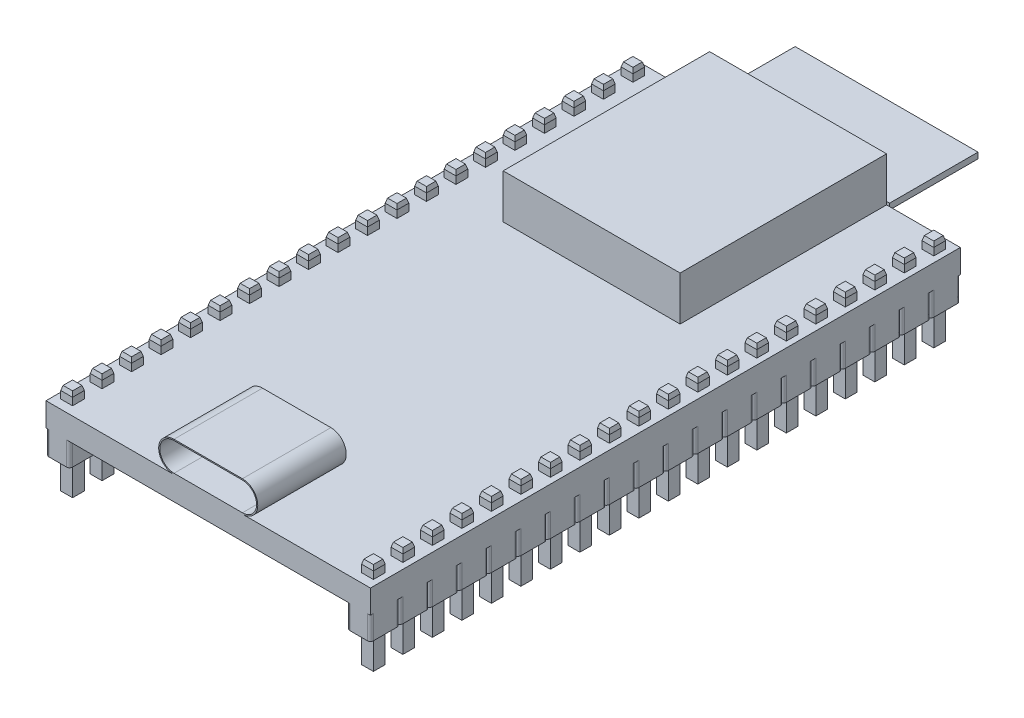
from build123d import *
from OCP.BRepFilletAPI import BRepFilletAPI_MakeChamfer

# Parameters (mm, degrees)
SKETCH1_W                = 27.5
SKETCH1_H                = 50
BOSS_EXTRUDE1_DEPTH      = 2
BOSS_EXTRUDE2_DEPTH      = 2
BOSS_EXTRUDE3_DEPTH      = 2.75
BOSS_EXTRUDE3_DEPTH_BACK = 5
SKETCH3_W                = 1
SKETCH3_H                = 1
SKETCH4_W                = 15
SKETCH4_H                = 17.5
BOSS_EXTRUDE4_DEPTH      = 3.75
SKETCH5_W                = 15.5
SKETCH5_H                = 0.5
BOSS_EXTRUDE5_DEPTH      = 7.5
CHAMFER1_SIZE            = 0.1
CHAMFER1_SIZE2           = 0.373205081
BOSS_EXTRUDE6_DEPTH      = 7.5
BOSS_EXTRUDE7_START      = -0.1
BOSS_EXTRUDE7_DEPTH      = 0.1


with BuildPart() as part:
    # Sketch1 → Boss-Extrude1 (new body)
    with BuildSketch(Plane(origin=(0, 0, 0), x_dir=(1, 0, 0), z_dir=(0, 1, 0))):
        Rectangle(SKETCH1_W, SKETCH1_H)
    extrude(amount=BOSS_EXTRUDE1_DEPTH)

    # Sketch2 → Boss-Extrude2 (add)
    with BuildSketch(Plane.XZ):
        with BuildLine():
            ThreePointArc((-11.75, 22.25), (-11.823223305, 22.426776695), (-12, 22.5))
            ThreePointArc((-12, 22.5), (-11.823223305, 22.573223305), (-11.75, 22.75))
            Line((-11.75, 22.75), (-11.75, 24.75))
            ThreePointArc((-11.75, 24.75), (-11.823223305, 24.926776695), (-12, 25))
            Line((-12, 25), (-13.5, 25))
            ThreePointArc((-13.5, 25), (-13.676776695, 24.926776695), (-13.75, 24.75))
            Line((-13.75, 24.75), (-13.75, 22.75))
            ThreePointArc((-13.75, 22.75), (-13.676776695, 22.573223305), (-13.5, 22.5))
            ThreePointArc((-13.5, 22.5), (-13.676776695, 22.426776695), (-13.75, 22.25))
            Line((-13.75, 22.25), (-13.75, 20.25))
            ThreePointArc((-13.75, 20.25), (-13.676776695, 20.073223305), (-13.5, 20))
            ThreePointArc((-13.5, 20), (-13.676776695, 19.926776695), (-13.75, 19.75))
            Line((-13.75, 19.75), (-13.75, 17.75))
            ThreePointArc((-13.75, 17.75), (-13.676776695, 17.573223305), (-13.5, 17.5))
            ThreePointArc((-13.5, 17.5), (-13.676776695, 17.426776695), (-13.75, 17.25))
            Line((-13.75, 17.25), (-13.75, 15.25))
            ThreePointArc((-13.75, 15.25), (-13.676776695, 15.073223305), (-13.5, 15))
            ThreePointArc((-13.5, 15), (-13.676776695, 14.926776695), (-13.75, 14.75))
            Line((-13.75, 14.75), (-13.75, 12.75))
            ThreePointArc((-13.75, 12.75), (-13.676776695, 12.573223305), (-13.5, 12.5))
            ThreePointArc((-13.5, 12.5), (-13.676776695, 12.426776695), (-13.75, 12.25))
            Line((-13.75, 12.25), (-13.75, 10.25))
            ThreePointArc((-13.75, 10.25), (-13.676776695, 10.073223305), (-13.5, 10))
            ThreePointArc((-13.5, 10), (-13.676776695, 9.926776695), (-13.75, 9.75))
            Line((-13.75, 9.75), (-13.75, 7.75))
            ThreePointArc((-13.75, 7.75), (-13.676776695, 7.573223305), (-13.5, 7.5))
            ThreePointArc((-13.5, 7.5), (-13.676776695, 7.426776695), (-13.75, 7.25))
            Line((-13.75, 7.25), (-13.75, 5.25))
            ThreePointArc((-13.75, 5.25), (-13.676776695, 5.073223305), (-13.5, 5))
            ThreePointArc((-13.5, 5), (-13.676776695, 4.926776695), (-13.75, 4.75))
            Line((-13.75, 4.75), (-13.75, 2.75))
            ThreePointArc((-13.75, 2.75), (-13.676776695, 2.573223305), (-13.5, 2.5))
            ThreePointArc((-13.5, 2.5), (-13.676776695, 2.426776695), (-13.75, 2.25))
            Line((-13.75, 2.25), (-13.75, 0.25))
            ThreePointArc((-13.75, 0.25), (-13.676776695, 0.073223305), (-13.5, 0))
            ThreePointArc((-13.5, 0), (-13.676776695, -0.073223305), (-13.75, -0.25))
            Line((-13.75, -0.25), (-13.75, -2.25))
            ThreePointArc((-13.75, -2.25), (-13.676776695, -2.426776695), (-13.5, -2.5))
            ThreePointArc((-13.5, -2.5), (-13.676776695, -2.573223305), (-13.75, -2.75))
            Line((-13.75, -2.75), (-13.75, -4.75))
            ThreePointArc((-13.75, -4.75), (-13.676776695, -4.926776695), (-13.5, -5))
            ThreePointArc((-13.5, -5), (-13.676776695, -5.073223305), (-13.75, -5.25))
            Line((-13.75, -5.25), (-13.75, -7.25))
            ThreePointArc((-13.75, -7.25), (-13.676776695, -7.426776695), (-13.5, -7.5))
            ThreePointArc((-13.5, -7.5), (-13.676776695, -7.573223305), (-13.75, -7.75))
            Line((-13.75, -7.75), (-13.75, -9.75))
            ThreePointArc((-13.75, -9.75), (-13.676776695, -9.926776695), (-13.5, -10))
            ThreePointArc((-13.5, -10), (-13.676776695, -10.073223305), (-13.75, -10.25))
            Line((-13.75, -10.25), (-13.75, -12.25))
            ThreePointArc((-13.75, -12.25), (-13.676776695, -12.426776695), (-13.5, -12.5))
            ThreePointArc((-13.5, -12.5), (-13.676776695, -12.573223305), (-13.75, -12.75))
            Line((-13.75, -12.75), (-13.75, -14.75))
            ThreePointArc((-13.75, -14.75), (-13.676776695, -14.926776695), (-13.5, -15))
            ThreePointArc((-13.5, -15), (-13.676776695, -15.073223305), (-13.75, -15.25))
            Line((-13.75, -15.25), (-13.75, -17.25))
            ThreePointArc((-13.75, -17.25), (-13.676776695, -17.426776695), (-13.5, -17.5))
            ThreePointArc((-13.5, -17.5), (-13.676776695, -17.573223305), (-13.75, -17.75))
            Line((-13.75, -17.75), (-13.75, -19.75))
            ThreePointArc((-13.75, -19.75), (-13.676776695, -19.926776695), (-13.5, -20))
            ThreePointArc((-13.5, -20), (-13.676776695, -20.073223305), (-13.75, -20.25))
            Line((-13.75, -20.25), (-13.75, -22.25))
            ThreePointArc((-13.75, -22.25), (-13.676776695, -22.426776695), (-13.5, -22.5))
            ThreePointArc((-13.5, -22.5), (-13.676776695, -22.573223305), (-13.75, -22.75))
            Line((-13.75, -22.75), (-13.75, -24.75))
            ThreePointArc((-13.75, -24.75), (-13.676776695, -24.926776695), (-13.5, -25))
            Line((-13.5, -25), (-12, -25))
            ThreePointArc((-12, -25), (-11.823223305, -24.926776695), (-11.75, -24.75))
            Line((-11.75, -24.75), (-11.75, -22.75))
            ThreePointArc((-11.75, -22.75), (-11.823223305, -22.573223305), (-12, -22.5))
            ThreePointArc((-12, -22.5), (-11.823223305, -22.426776695), (-11.75, -22.25))
            Line((-11.75, -22.25), (-11.75, -20.25))
            ThreePointArc((-11.75, -20.25), (-11.823223305, -20.073223305), (-12, -20))
            ThreePointArc((-12, -20), (-11.823223305, -19.926776695), (-11.75, -19.75))
            Line((-11.75, -19.75), (-11.75, -17.75))
            ThreePointArc((-11.75, -17.75), (-11.823223305, -17.573223305), (-12, -17.5))
            ThreePointArc((-12, -17.5), (-11.823223305, -17.426776695), (-11.75, -17.25))
            Line((-11.75, -17.25), (-11.75, -15.25))
            ThreePointArc((-11.75, -15.25), (-11.823223305, -15.073223305), (-12, -15))
            ThreePointArc((-12, -15), (-11.823223305, -14.926776695), (-11.75, -14.75))
            Line((-11.75, -14.75), (-11.75, -12.75))
            ThreePointArc((-11.75, -12.75), (-11.823223305, -12.573223305), (-12, -12.5))
            ThreePointArc((-12, -12.5), (-11.823223305, -12.426776695), (-11.75, -12.25))
            Line((-11.75, -12.25), (-11.75, -10.25))
            ThreePointArc((-11.75, -10.25), (-11.823223305, -10.073223305), (-12, -10))
            ThreePointArc((-12, -10), (-11.823223305, -9.926776695), (-11.75, -9.75))
            Line((-11.75, -9.75), (-11.75, -7.75))
            ThreePointArc((-11.75, -7.75), (-11.823223305, -7.573223305), (-12, -7.5))
            ThreePointArc((-12, -7.5), (-11.823223305, -7.426776695), (-11.75, -7.25))
            Line((-11.75, -7.25), (-11.75, -5.25))
            ThreePointArc((-11.75, -5.25), (-11.823223305, -5.073223305), (-12, -5))
            ThreePointArc((-12, -5), (-11.823223305, -4.926776695), (-11.75, -4.75))
            Line((-11.75, -4.75), (-11.75, -2.75))
            ThreePointArc((-11.75, -2.75), (-11.823223305, -2.573223305), (-12, -2.5))
            ThreePointArc((-12, -2.5), (-11.823223305, -2.426776695), (-11.75, -2.25))
            Line((-11.75, -2.25), (-11.75, -0.25))
            ThreePointArc((-11.75, -0.25), (-11.823223305, -0.073223305), (-12, 0))
            ThreePointArc((-12, 0), (-11.823223305, 0.073223305), (-11.75, 0.25))
            Line((-11.75, 0.25), (-11.75, 2.25))
            ThreePointArc((-11.75, 2.25), (-11.823223305, 2.426776695), (-12, 2.5))
            ThreePointArc((-12, 2.5), (-11.823223305, 2.573223305), (-11.75, 2.75))
            Line((-11.75, 2.75), (-11.75, 4.75))
            ThreePointArc((-11.75, 4.75), (-11.823223305, 4.926776695), (-12, 5))
            ThreePointArc((-12, 5), (-11.823223305, 5.073223305), (-11.75, 5.25))
            Line((-11.75, 5.25), (-11.75, 7.25))
            ThreePointArc((-11.75, 7.25), (-11.823223305, 7.426776695), (-12, 7.5))
            ThreePointArc((-12, 7.5), (-11.823223305, 7.573223305), (-11.75, 7.75))
            Line((-11.75, 7.75), (-11.75, 9.75))
            ThreePointArc((-11.75, 9.75), (-11.823223305, 9.926776695), (-12, 10))
            ThreePointArc((-12, 10), (-11.823223305, 10.073223305), (-11.75, 10.25))
            Line((-11.75, 10.25), (-11.75, 12.25))
            ThreePointArc((-11.75, 12.25), (-11.823223305, 12.426776695), (-12, 12.5))
            ThreePointArc((-12, 12.5), (-11.823223305, 12.573223305), (-11.75, 12.75))
            Line((-11.75, 12.75), (-11.75, 14.75))
            ThreePointArc((-11.75, 14.75), (-11.823223305, 14.926776695), (-12, 15))
            ThreePointArc((-12, 15), (-11.823223305, 15.073223305), (-11.75, 15.25))
            Line((-11.75, 15.25), (-11.75, 17.25))
            ThreePointArc((-11.75, 17.25), (-11.823223305, 17.426776695), (-12, 17.5))
            ThreePointArc((-12, 17.5), (-11.823223305, 17.573223305), (-11.75, 17.75))
            Line((-11.75, 17.75), (-11.75, 19.75))
            ThreePointArc((-11.75, 19.75), (-11.823223305, 19.926776695), (-12, 20))
            ThreePointArc((-12, 20), (-11.823223305, 20.073223305), (-11.75, 20.25))
            Line((-11.75, 20.25), (-11.75, 22.25))
        make_face()
        with BuildLine():
            Line((13.5, 25), (12, 25))
            ThreePointArc((12, 25), (11.823223305, 24.926776695), (11.75, 24.75))
            Line((11.75, 24.75), (11.75, 22.75))
            ThreePointArc((11.75, 22.75), (11.823223305, 22.573223305), (12, 22.5))
            ThreePointArc((12, 22.5), (11.823223305, 22.426776695), (11.75, 22.25))
            Line((11.75, 22.25), (11.75, 20.25))
            ThreePointArc((11.75, 20.25), (11.823223305, 20.073223305), (12, 20))
            ThreePointArc((12, 20), (11.823223305, 19.926776695), (11.75, 19.75))
            Line((11.75, 19.75), (11.75, 17.75))
            ThreePointArc((11.75, 17.75), (11.823223305, 17.573223305), (12, 17.5))
            ThreePointArc((12, 17.5), (11.823223305, 17.426776695), (11.75, 17.25))
            Line((11.75, 17.25), (11.75, 15.25))
            ThreePointArc((11.75, 15.25), (11.823223305, 15.073223305), (12, 15))
            ThreePointArc((12, 15), (11.823223305, 14.926776695), (11.75, 14.75))
            Line((11.75, 14.75), (11.75, 12.75))
            ThreePointArc((11.75, 12.75), (11.823223305, 12.573223305), (12, 12.5))
            ThreePointArc((12, 12.5), (11.823223305, 12.426776695), (11.75, 12.25))
            Line((11.75, 12.25), (11.75, 10.25))
            ThreePointArc((11.75, 10.25), (11.823223305, 10.073223305), (12, 10))
            ThreePointArc((12, 10), (11.823223305, 9.926776695), (11.75, 9.75))
            Line((11.75, 9.75), (11.75, 7.75))
            ThreePointArc((11.75, 7.75), (11.823223305, 7.573223305), (12, 7.5))
            ThreePointArc((12, 7.5), (11.823223305, 7.426776695), (11.75, 7.25))
            Line((11.75, 7.25), (11.75, 5.25))
            ThreePointArc((11.75, 5.25), (11.823223305, 5.073223305), (12, 5))
            ThreePointArc((12, 5), (11.823223305, 4.926776695), (11.75, 4.75))
            Line((11.75, 4.75), (11.75, 2.75))
            ThreePointArc((11.75, 2.75), (11.823223305, 2.573223305), (12, 2.5))
            ThreePointArc((12, 2.5), (11.823223305, 2.426776695), (11.75, 2.25))
            Line((11.75, 2.25), (11.75, 0.25))
            ThreePointArc((11.75, 0.25), (11.823223305, 0.073223305), (12, 0))
            ThreePointArc((12, 0), (11.823223305, -0.073223305), (11.75, -0.25))
            Line((11.75, -0.25), (11.75, -2.25))
            ThreePointArc((11.75, -2.25), (11.823223305, -2.426776695), (12, -2.5))
            ThreePointArc((12, -2.5), (11.823223305, -2.573223305), (11.75, -2.75))
            Line((11.75, -2.75), (11.75, -4.75))
            ThreePointArc((11.75, -4.75), (11.823223305, -4.926776695), (12, -5))
            ThreePointArc((12, -5), (11.823223305, -5.073223305), (11.75, -5.25))
            Line((11.75, -5.25), (11.75, -7.25))
            ThreePointArc((11.75, -7.25), (11.823223305, -7.426776695), (12, -7.5))
            ThreePointArc((12, -7.5), (11.823223305, -7.573223305), (11.75, -7.75))
            Line((11.75, -7.75), (11.75, -9.75))
            ThreePointArc((11.75, -9.75), (11.823223305, -9.926776695), (12, -10))
            ThreePointArc((12, -10), (11.823223305, -10.073223305), (11.75, -10.25))
            Line((11.75, -10.25), (11.75, -12.25))
            ThreePointArc((11.75, -12.25), (11.823223305, -12.426776695), (12, -12.5))
            ThreePointArc((12, -12.5), (11.823223305, -12.573223305), (11.75, -12.75))
            Line((11.75, -12.75), (11.75, -14.75))
            ThreePointArc((11.75, -14.75), (11.823223305, -14.926776695), (12, -15))
            ThreePointArc((12, -15), (11.823223305, -15.073223305), (11.75, -15.25))
            Line((11.75, -15.25), (11.75, -17.25))
            ThreePointArc((11.75, -17.25), (11.823223305, -17.426776695), (12, -17.5))
            ThreePointArc((12, -17.5), (11.823223305, -17.573223305), (11.75, -17.75))
            Line((11.75, -17.75), (11.75, -19.75))
            ThreePointArc((11.75, -19.75), (11.823223305, -19.926776695), (12, -20))
            ThreePointArc((12, -20), (11.823223305, -20.073223305), (11.75, -20.25))
            Line((11.75, -20.25), (11.75, -22.25))
            ThreePointArc((11.75, -22.25), (11.823223305, -22.426776695), (12, -22.5))
            ThreePointArc((12, -22.5), (11.823223305, -22.573223305), (11.75, -22.75))
            Line((11.75, -22.75), (11.75, -24.75))
            ThreePointArc((11.75, -24.75), (11.823223305, -24.926776695), (12, -25))
            Line((12, -25), (13.5, -25))
            ThreePointArc((13.5, -25), (13.676776695, -24.926776695), (13.75, -24.75))
            Line((13.75, -24.75), (13.75, -22.75))
            ThreePointArc((13.75, -22.75), (13.676776695, -22.573223305), (13.5, -22.5))
            ThreePointArc((13.5, -22.5), (13.676776695, -22.426776695), (13.75, -22.25))
            Line((13.75, -22.25), (13.75, -20.25))
            ThreePointArc((13.75, -20.25), (13.676776695, -20.073223305), (13.5, -20))
            ThreePointArc((13.5, -20), (13.676776695, -19.926776695), (13.75, -19.75))
            Line((13.75, -19.75), (13.75, -17.75))
            ThreePointArc((13.75, -17.75), (13.676776695, -17.573223305), (13.5, -17.5))
            ThreePointArc((13.5, -17.5), (13.676776695, -17.426776695), (13.75, -17.25))
            Line((13.75, -17.25), (13.75, -15.25))
            ThreePointArc((13.75, -15.25), (13.676776695, -15.073223305), (13.5, -15))
            ThreePointArc((13.5, -15), (13.676776695, -14.926776695), (13.75, -14.75))
            Line((13.75, -14.75), (13.75, -12.75))
            ThreePointArc((13.75, -12.75), (13.676776695, -12.573223305), (13.5, -12.5))
            ThreePointArc((13.5, -12.5), (13.676776695, -12.426776695), (13.75, -12.25))
            Line((13.75, -12.25), (13.75, -10.25))
            ThreePointArc((13.75, -10.25), (13.676776695, -10.073223305), (13.5, -10))
            ThreePointArc((13.5, -10), (13.676776695, -9.926776695), (13.75, -9.75))
            Line((13.75, -9.75), (13.75, -7.75))
            ThreePointArc((13.75, -7.75), (13.676776695, -7.573223305), (13.5, -7.5))
            ThreePointArc((13.5, -7.5), (13.676776695, -7.426776695), (13.75, -7.25))
            Line((13.75, -7.25), (13.75, -5.25))
            ThreePointArc((13.75, -5.25), (13.676776695, -5.073223305), (13.5, -5))
            ThreePointArc((13.5, -5), (13.676776695, -4.926776695), (13.75, -4.75))
            Line((13.75, -4.75), (13.75, -2.75))
            ThreePointArc((13.75, -2.75), (13.676776695, -2.573223305), (13.5, -2.5))
            ThreePointArc((13.5, -2.5), (13.676776695, -2.426776695), (13.75, -2.25))
            Line((13.75, -2.25), (13.75, -0.25))
            ThreePointArc((13.75, -0.25), (13.676776695, -0.073223305), (13.5, 0))
            ThreePointArc((13.5, 0), (13.676776695, 0.073223305), (13.75, 0.25))
            Line((13.75, 0.25), (13.75, 2.25))
            ThreePointArc((13.75, 2.25), (13.676776695, 2.426776695), (13.5, 2.5))
            ThreePointArc((13.5, 2.5), (13.676776695, 2.573223305), (13.75, 2.75))
            Line((13.75, 2.75), (13.75, 4.75))
            ThreePointArc((13.75, 4.75), (13.676776695, 4.926776695), (13.5, 5))
            ThreePointArc((13.5, 5), (13.676776695, 5.073223305), (13.75, 5.25))
            Line((13.75, 5.25), (13.75, 7.25))
            ThreePointArc((13.75, 7.25), (13.676776695, 7.426776695), (13.5, 7.5))
            ThreePointArc((13.5, 7.5), (13.676776695, 7.573223305), (13.75, 7.75))
            Line((13.75, 7.75), (13.75, 9.75))
            ThreePointArc((13.75, 9.75), (13.676776695, 9.926776695), (13.5, 10))
            ThreePointArc((13.5, 10), (13.676776695, 10.073223305), (13.75, 10.25))
            Line((13.75, 10.25), (13.75, 12.25))
            ThreePointArc((13.75, 12.25), (13.676776695, 12.426776695), (13.5, 12.5))
            ThreePointArc((13.5, 12.5), (13.676776695, 12.573223305), (13.75, 12.75))
            Line((13.75, 12.75), (13.75, 14.75))
            ThreePointArc((13.75, 14.75), (13.676776695, 14.926776695), (13.5, 15))
            ThreePointArc((13.5, 15), (13.676776695, 15.073223305), (13.75, 15.25))
            Line((13.75, 15.25), (13.75, 17.25))
            ThreePointArc((13.75, 17.25), (13.676776695, 17.426776695), (13.5, 17.5))
            ThreePointArc((13.5, 17.5), (13.676776695, 17.573223305), (13.75, 17.75))
            Line((13.75, 17.75), (13.75, 19.75))
            ThreePointArc((13.75, 19.75), (13.676776695, 19.926776695), (13.5, 20))
            ThreePointArc((13.5, 20), (13.676776695, 20.073223305), (13.75, 20.25))
            Line((13.75, 20.25), (13.75, 22.25))
            ThreePointArc((13.75, 22.25), (13.676776695, 22.426776695), (13.5, 22.5))
            ThreePointArc((13.5, 22.5), (13.676776695, 22.573223305), (13.75, 22.75))
            Line((13.75, 22.75), (13.75, 24.75))
            ThreePointArc((13.75, 24.75), (13.676776695, 24.926776695), (13.5, 25))
        make_face()
    extrude(amount=BOSS_EXTRUDE2_DEPTH)

    # Sketch3 → Boss-Extrude3 (add, two sides: drawn at the far end of the back side and taken through both)
    with BuildSketch(Plane.XZ.offset(2).offset(-BOSS_EXTRUDE3_DEPTH_BACK)):
        with Locations((12.75, 23.75)):
            Rectangle(SKETCH3_W, SKETCH3_H)
        with Locations((12.75, 21.25)):
            Rectangle(SKETCH3_W, SKETCH3_H)
        with Locations((12.75, 18.75)):
            Rectangle(SKETCH3_W, SKETCH3_H)
        with Locations((12.75, 16.25)):
            Rectangle(SKETCH3_W, SKETCH3_H)
        with Locations((12.75, 13.75)):
            Rectangle(SKETCH3_W, SKETCH3_H)
        with Locations((12.75, 11.25)):
            Rectangle(SKETCH3_W, SKETCH3_H)
        with Locations((12.75, 8.75)):
            Rectangle(SKETCH3_W, SKETCH3_H)
        with Locations((12.75, 6.25)):
            Rectangle(SKETCH3_W, SKETCH3_H)
        with Locations((12.75, 3.75)):
            Rectangle(SKETCH3_W, SKETCH3_H)
        with Locations((12.75, 1.25)):
            Rectangle(SKETCH3_W, SKETCH3_H)
        with Locations((12.75, -1.25)):
            Rectangle(SKETCH3_W, SKETCH3_H)
        with Locations((12.75, -3.75)):
            Rectangle(SKETCH3_W, SKETCH3_H)
        with Locations((12.75, -6.25)):
            Rectangle(SKETCH3_W, SKETCH3_H)
        with Locations((12.75, -8.75)):
            Rectangle(SKETCH3_W, SKETCH3_H)
        with Locations((12.75, -11.25)):
            Rectangle(SKETCH3_W, SKETCH3_H)
        with Locations((12.75, -13.75)):
            Rectangle(SKETCH3_W, SKETCH3_H)
        with Locations((12.75, -16.25)):
            Rectangle(SKETCH3_W, SKETCH3_H)
        with Locations((12.75, -18.75)):
            Rectangle(SKETCH3_W, SKETCH3_H)
        with Locations((12.75, -21.25)):
            Rectangle(SKETCH3_W, SKETCH3_H)
        with Locations((12.75, -23.75)):
            Rectangle(SKETCH3_W, SKETCH3_H)
        with Locations((-12.75, -23.75)):
            Rectangle(SKETCH3_W, SKETCH3_H)
        with Locations((-12.75, -21.25)):
            Rectangle(SKETCH3_W, SKETCH3_H)
        with Locations((-12.75, -18.75)):
            Rectangle(SKETCH3_W, SKETCH3_H)
        with Locations((-12.75, -16.25)):
            Rectangle(SKETCH3_W, SKETCH3_H)
        with Locations((-12.75, -13.75)):
            Rectangle(SKETCH3_W, SKETCH3_H)
        with Locations((-12.75, -11.25)):
            Rectangle(SKETCH3_W, SKETCH3_H)
        with Locations((-12.75, -8.75)):
            Rectangle(SKETCH3_W, SKETCH3_H)
        with Locations((-12.75, -6.25)):
            Rectangle(SKETCH3_W, SKETCH3_H)
        with Locations((-12.75, -3.75)):
            Rectangle(SKETCH3_W, SKETCH3_H)
        with Locations((-12.75, -1.25)):
            Rectangle(SKETCH3_W, SKETCH3_H)
        with Locations((-12.75, 1.25)):
            Rectangle(SKETCH3_W, SKETCH3_H)
        with Locations((-12.75, 3.75)):
            Rectangle(SKETCH3_W, SKETCH3_H)
        with Locations((-12.75, 6.25)):
            Rectangle(SKETCH3_W, SKETCH3_H)
        with Locations((-12.75, 8.75)):
            Rectangle(SKETCH3_W, SKETCH3_H)
        with Locations((-12.75, 11.25)):
            Rectangle(SKETCH3_W, SKETCH3_H)
        with Locations((-12.75, 13.75)):
            Rectangle(SKETCH3_W, SKETCH3_H)
        with Locations((-12.75, 16.25)):
            Rectangle(SKETCH3_W, SKETCH3_H)
        with Locations((-12.75, 18.75)):
            Rectangle(SKETCH3_W, SKETCH3_H)
        with Locations((-12.75, 21.25)):
            Rectangle(SKETCH3_W, SKETCH3_H)
        with Locations((-12.75, 23.75)):
            Rectangle(SKETCH3_W, SKETCH3_H)
    extrude(amount=BOSS_EXTRUDE3_DEPTH + BOSS_EXTRUDE3_DEPTH_BACK)

    # Sketch4 → Boss-Extrude4 (add)
    with BuildSketch(Plane(origin=(0, 2, 0), x_dir=(1, 0, 0), z_dir=(0, 1, 0))):
        with Locations((0, 16.25)):
            Rectangle(SKETCH4_W, SKETCH4_H)
    extrude(amount=BOSS_EXTRUDE4_DEPTH)

    # Sketch5 → Boss-Extrude5 (add)
    with BuildSketch(Plane(origin=(0, 0, -25), x_dir=(-1, 0, 0), z_dir=(0, 0, -1))):
        with Locations((0, 2)):
            Rectangle(SKETCH5_W, SKETCH5_H)
    extrude(amount=BOSS_EXTRUDE5_DEPTH)

    # Chamfer1: one chamfer whose edges measure the first distance from different faces: ONE call of the kernel's chamfer builder (chamfer() names one face for all edges)
    chamfer1_edges_1 = [part.edges().sort_by_distance(p)[0] for p in [
        (12.75, 3, 24.25),
        (12.25, 3, 23.75),
        (12.75, 3, 23.25),
        (13.25, 3, 23.75),
    ]]
    chamfer1_side_1 = [part.faces().sort_by_distance(p)[0] for p in [
        (12.75, 3, 23.75),
    ]]
    chamfer1_edges_2 = [part.edges().sort_by_distance(p)[0] for p in [
        (13.25, 3, 21.25),
        (12.75, 3, 21.75),
        (12.25, 3, 21.25),
        (12.75, 3, 20.75),
    ]]
    chamfer1_side_2 = [part.faces().sort_by_distance(p)[0] for p in [
        (12.75, 3, 21.25),
    ]]
    chamfer1_edges_3 = [part.edges().sort_by_distance(p)[0] for p in [
        (13.25, 3, 18.75),
        (12.75, 3, 19.25),
        (12.25, 3, 18.75),
        (12.75, 3, 18.25),
    ]]
    chamfer1_side_3 = [part.faces().sort_by_distance(p)[0] for p in [
        (12.75, 3, 18.75),
    ]]
    chamfer1_edges_4 = [part.edges().sort_by_distance(p)[0] for p in [
        (13.25, 3, 16.25),
        (12.75, 3, 16.75),
        (12.25, 3, 16.25),
        (12.75, 3, 15.75),
    ]]
    chamfer1_side_4 = [part.faces().sort_by_distance(p)[0] for p in [
        (12.75, 3, 16.25),
    ]]
    chamfer1_edges_5 = [part.edges().sort_by_distance(p)[0] for p in [
        (13.25, 3, 13.75),
        (12.75, 3, 14.25),
        (12.25, 3, 13.75),
        (12.75, 3, 13.25),
    ]]
    chamfer1_side_5 = [part.faces().sort_by_distance(p)[0] for p in [
        (12.75, 3, 13.75),
    ]]
    chamfer1_edges_6 = [part.edges().sort_by_distance(p)[0] for p in [
        (13.25, 3, 11.25),
        (12.75, 3, 11.75),
        (12.25, 3, 11.25),
        (12.75, 3, 10.75),
    ]]
    chamfer1_side_6 = [part.faces().sort_by_distance(p)[0] for p in [
        (12.75, 3, 11.25),
    ]]
    chamfer1_edges_7 = [part.edges().sort_by_distance(p)[0] for p in [
        (13.25, 3, 8.75),
        (12.75, 3, 9.25),
        (12.25, 3, 8.75),
        (12.75, 3, 8.25),
    ]]
    chamfer1_side_7 = [part.faces().sort_by_distance(p)[0] for p in [
        (12.75, 3, 8.75),
    ]]
    chamfer1_edges_8 = [part.edges().sort_by_distance(p)[0] for p in [
        (13.25, 3, 6.25),
        (12.75, 3, 6.75),
        (12.25, 3, 6.25),
        (12.75, 3, 5.75),
    ]]
    chamfer1_side_8 = [part.faces().sort_by_distance(p)[0] for p in [
        (12.75, 3, 6.25),
    ]]
    chamfer1_edges_9 = [part.edges().sort_by_distance(p)[0] for p in [
        (13.25, 3, 3.75),
        (12.75, 3, 4.25),
        (12.25, 3, 3.75),
        (12.75, 3, 3.25),
    ]]
    chamfer1_side_9 = [part.faces().sort_by_distance(p)[0] for p in [
        (12.75, 3, 3.75),
    ]]
    chamfer1_edges_10 = [part.edges().sort_by_distance(p)[0] for p in [
        (13.25, 3, 1.25),
        (12.75, 3, 1.75),
        (12.25, 3, 1.25),
        (12.75, 3, 0.75),
    ]]
    chamfer1_side_10 = [part.faces().sort_by_distance(p)[0] for p in [
        (12.75, 3, 1.25),
    ]]
    chamfer1_edges_11 = [part.edges().sort_by_distance(p)[0] for p in [
        (13.25, 3, -1.25),
        (12.75, 3, -0.75),
        (12.25, 3, -1.25),
        (12.75, 3, -1.75),
    ]]
    chamfer1_side_11 = [part.faces().sort_by_distance(p)[0] for p in [
        (12.75, 3, -1.25),
    ]]
    chamfer1_edges_12 = [part.edges().sort_by_distance(p)[0] for p in [
        (13.25, 3, -3.75),
        (12.75, 3, -3.25),
        (12.25, 3, -3.75),
        (12.75, 3, -4.25),
    ]]
    chamfer1_side_12 = [part.faces().sort_by_distance(p)[0] for p in [
        (12.75, 3, -3.75),
    ]]
    chamfer1_edges_13 = [part.edges().sort_by_distance(p)[0] for p in [
        (13.25, 3, -6.25),
        (12.75, 3, -5.75),
        (12.25, 3, -6.25),
        (12.75, 3, -6.75),
    ]]
    chamfer1_side_13 = [part.faces().sort_by_distance(p)[0] for p in [
        (12.75, 3, -6.25),
    ]]
    chamfer1_edges_14 = [part.edges().sort_by_distance(p)[0] for p in [
        (13.25, 3, -8.75),
        (12.75, 3, -8.25),
        (12.25, 3, -8.75),
        (12.75, 3, -9.25),
    ]]
    chamfer1_side_14 = [part.faces().sort_by_distance(p)[0] for p in [
        (12.75, 3, -8.75),
    ]]
    chamfer1_edges_15 = [part.edges().sort_by_distance(p)[0] for p in [
        (13.25, 3, -11.25),
        (12.75, 3, -10.75),
        (12.25, 3, -11.25),
        (12.75, 3, -11.75),
    ]]
    chamfer1_side_15 = [part.faces().sort_by_distance(p)[0] for p in [
        (12.75, 3, -11.25),
    ]]
    chamfer1_edges_16 = [part.edges().sort_by_distance(p)[0] for p in [
        (13.25, 3, -13.75),
        (12.75, 3, -13.25),
        (12.25, 3, -13.75),
        (12.75, 3, -14.25),
    ]]
    chamfer1_side_16 = [part.faces().sort_by_distance(p)[0] for p in [
        (12.75, 3, -13.75),
    ]]
    chamfer1_edges_17 = [part.edges().sort_by_distance(p)[0] for p in [
        (13.25, 3, -16.25),
        (12.75, 3, -15.75),
        (12.25, 3, -16.25),
        (12.75, 3, -16.75),
    ]]
    chamfer1_side_17 = [part.faces().sort_by_distance(p)[0] for p in [
        (12.75, 3, -16.25),
    ]]
    chamfer1_edges_18 = [part.edges().sort_by_distance(p)[0] for p in [
        (13.25, 3, -18.75),
        (12.75, 3, -18.25),
        (12.25, 3, -18.75),
        (12.75, 3, -19.25),
    ]]
    chamfer1_side_18 = [part.faces().sort_by_distance(p)[0] for p in [
        (12.75, 3, -18.75),
    ]]
    chamfer1_edges_19 = [part.edges().sort_by_distance(p)[0] for p in [
        (13.25, 3, -21.25),
        (12.75, 3, -20.75),
        (12.25, 3, -21.25),
        (12.75, 3, -21.75),
    ]]
    chamfer1_side_19 = [part.faces().sort_by_distance(p)[0] for p in [
        (12.75, 3, -21.25),
    ]]
    chamfer1_edges_20 = [part.edges().sort_by_distance(p)[0] for p in [
        (13.25, 3, -23.75),
        (12.75, 3, -23.25),
        (12.25, 3, -23.75),
        (12.75, 3, -24.25),
    ]]
    chamfer1_side_20 = [part.faces().sort_by_distance(p)[0] for p in [
        (12.75, 3, -23.75),
    ]]
    chamfer1_edges_21 = [part.edges().sort_by_distance(p)[0] for p in [
        (-12.75, 3, 9.25),
        (-13.25, 3, 8.75),
        (-12.75, 3, 8.25),
        (-12.25, 3, 8.75),
    ]]
    chamfer1_side_21 = [part.faces().sort_by_distance(p)[0] for p in [
        (-12.75, 3, 8.75),
    ]]
    chamfer1_edges_22 = [part.edges().sort_by_distance(p)[0] for p in [
        (-12.75, 3, 6.75),
        (-13.25, 3, 6.25),
        (-12.75, 3, 5.75),
        (-12.25, 3, 6.25),
    ]]
    chamfer1_side_22 = [part.faces().sort_by_distance(p)[0] for p in [
        (-12.75, 3, 6.25),
    ]]
    chamfer1_edges_23 = [part.edges().sort_by_distance(p)[0] for p in [
        (-12.75, 3, 4.25),
        (-13.25, 3, 3.75),
        (-12.75, 3, 3.25),
        (-12.25, 3, 3.75),
    ]]
    chamfer1_side_23 = [part.faces().sort_by_distance(p)[0] for p in [
        (-12.75, 3, 3.75),
    ]]
    chamfer1_edges_24 = [part.edges().sort_by_distance(p)[0] for p in [
        (-12.75, 3, 1.75),
        (-13.25, 3, 1.25),
        (-12.75, 3, 0.75),
        (-12.25, 3, 1.25),
    ]]
    chamfer1_side_24 = [part.faces().sort_by_distance(p)[0] for p in [
        (-12.75, 3, 1.25),
    ]]
    chamfer1_edges_25 = [part.edges().sort_by_distance(p)[0] for p in [
        (-12.75, 3, -0.75),
        (-13.25, 3, -1.25),
        (-12.75, 3, -1.75),
        (-12.25, 3, -1.25),
    ]]
    chamfer1_side_25 = [part.faces().sort_by_distance(p)[0] for p in [
        (-12.75, 3, -1.25),
    ]]
    chamfer1_edges_26 = [part.edges().sort_by_distance(p)[0] for p in [
        (-12.75, 3, -3.25),
        (-13.25, 3, -3.75),
        (-12.75, 3, -4.25),
        (-12.25, 3, -3.75),
    ]]
    chamfer1_side_26 = [part.faces().sort_by_distance(p)[0] for p in [
        (-12.75, 3, -3.75),
    ]]
    chamfer1_edges_27 = [part.edges().sort_by_distance(p)[0] for p in [
        (-12.75, 3, -5.75),
        (-13.25, 3, -6.25),
        (-12.75, 3, -6.75),
        (-12.25, 3, -6.25),
    ]]
    chamfer1_side_27 = [part.faces().sort_by_distance(p)[0] for p in [
        (-12.75, 3, -6.25),
    ]]
    chamfer1_edges_28 = [part.edges().sort_by_distance(p)[0] for p in [
        (-12.75, 3, -8.25),
        (-13.25, 3, -8.75),
        (-12.75, 3, -9.25),
        (-12.25, 3, -8.75),
    ]]
    chamfer1_side_28 = [part.faces().sort_by_distance(p)[0] for p in [
        (-12.75, 3, -8.75),
    ]]
    chamfer1_edges_29 = [part.edges().sort_by_distance(p)[0] for p in [
        (-12.75, 3, -10.75),
        (-13.25, 3, -11.25),
        (-12.75, 3, -11.75),
        (-12.25, 3, -11.25),
    ]]
    chamfer1_side_29 = [part.faces().sort_by_distance(p)[0] for p in [
        (-12.75, 3, -11.25),
    ]]
    chamfer1_edges_30 = [part.edges().sort_by_distance(p)[0] for p in [
        (-12.75, 3, -13.25),
        (-13.25, 3, -13.75),
        (-12.75, 3, -14.25),
        (-12.25, 3, -13.75),
    ]]
    chamfer1_side_30 = [part.faces().sort_by_distance(p)[0] for p in [
        (-12.75, 3, -13.75),
    ]]
    chamfer1_edges_31 = [part.edges().sort_by_distance(p)[0] for p in [
        (-12.75, 3, -15.75),
        (-13.25, 3, -16.25),
        (-12.75, 3, -16.75),
        (-12.25, 3, -16.25),
    ]]
    chamfer1_side_31 = [part.faces().sort_by_distance(p)[0] for p in [
        (-12.75, 3, -16.25),
    ]]
    chamfer1_edges_32 = [part.edges().sort_by_distance(p)[0] for p in [
        (-12.75, 3, -18.25),
        (-13.25, 3, -18.75),
        (-12.75, 3, -19.25),
        (-12.25, 3, -18.75),
    ]]
    chamfer1_side_32 = [part.faces().sort_by_distance(p)[0] for p in [
        (-12.75, 3, -18.75),
    ]]
    chamfer1_edges_33 = [part.edges().sort_by_distance(p)[0] for p in [
        (-12.75, 3, -20.75),
        (-13.25, 3, -21.25),
        (-12.75, 3, -21.75),
        (-12.25, 3, -21.25),
    ]]
    chamfer1_side_33 = [part.faces().sort_by_distance(p)[0] for p in [
        (-12.75, 3, -21.25),
    ]]
    chamfer1_edges_34 = [part.edges().sort_by_distance(p)[0] for p in [
        (-12.75, 3, -23.25),
        (-13.25, 3, -23.75),
        (-12.75, 3, -24.25),
        (-12.25, 3, -23.75),
    ]]
    chamfer1_side_34 = [part.faces().sort_by_distance(p)[0] for p in [
        (-12.75, 3, -23.75),
    ]]
    chamfer1_edges_35 = [part.edges().sort_by_distance(p)[0] for p in [
        (-12.75, 3, 11.75),
        (-13.25, 3, 11.25),
        (-12.75, 3, 10.75),
        (-12.25, 3, 11.25),
    ]]
    chamfer1_side_35 = [part.faces().sort_by_distance(p)[0] for p in [
        (-12.75, 3, 11.25),
    ]]
    chamfer1_edges_36 = [part.edges().sort_by_distance(p)[0] for p in [
        (-12.75, 3, 14.25),
        (-13.25, 3, 13.75),
        (-12.75, 3, 13.25),
        (-12.25, 3, 13.75),
    ]]
    chamfer1_side_36 = [part.faces().sort_by_distance(p)[0] for p in [
        (-12.75, 3, 13.75),
    ]]
    chamfer1_edges_37 = [part.edges().sort_by_distance(p)[0] for p in [
        (-12.75, 3, 16.75),
        (-13.25, 3, 16.25),
        (-12.75, 3, 15.75),
        (-12.25, 3, 16.25),
    ]]
    chamfer1_side_37 = [part.faces().sort_by_distance(p)[0] for p in [
        (-12.75, 3, 16.25),
    ]]
    chamfer1_edges_38 = [part.edges().sort_by_distance(p)[0] for p in [
        (-12.75, 3, 19.25),
        (-13.25, 3, 18.75),
        (-12.75, 3, 18.25),
        (-12.25, 3, 18.75),
    ]]
    chamfer1_side_38 = [part.faces().sort_by_distance(p)[0] for p in [
        (-12.75, 3, 18.75),
    ]]
    chamfer1_edges_39 = [part.edges().sort_by_distance(p)[0] for p in [
        (-12.75, 3, 21.75),
        (-13.25, 3, 21.25),
        (-12.75, 3, 20.75),
        (-12.25, 3, 21.25),
    ]]
    chamfer1_side_39 = [part.faces().sort_by_distance(p)[0] for p in [
        (-12.75, 3, 21.25),
    ]]
    chamfer1_edges_40 = [part.edges().sort_by_distance(p)[0] for p in [
        (-12.75, 3, 24.25),
        (-13.25, 3, 23.75),
        (-12.75, 3, 23.25),
        (-12.25, 3, 23.75),
    ]]
    chamfer1_side_40 = [part.faces().sort_by_distance(p)[0] for p in [
        (-12.75, 3, 23.75),
    ]]
    chamfer1 = BRepFilletAPI_MakeChamfer(part.part.solid().wrapped)
    for e in chamfer1_edges_1:
        chamfer1.Add(CHAMFER1_SIZE, CHAMFER1_SIZE2, e.wrapped, chamfer1_side_1[0].wrapped)  # the first distance lies on this face
    for e in chamfer1_edges_2:
        chamfer1.Add(CHAMFER1_SIZE, CHAMFER1_SIZE2, e.wrapped, chamfer1_side_2[0].wrapped)  # the first distance lies on this face
    for e in chamfer1_edges_3:
        chamfer1.Add(CHAMFER1_SIZE, CHAMFER1_SIZE2, e.wrapped, chamfer1_side_3[0].wrapped)  # the first distance lies on this face
    for e in chamfer1_edges_4:
        chamfer1.Add(CHAMFER1_SIZE, CHAMFER1_SIZE2, e.wrapped, chamfer1_side_4[0].wrapped)  # the first distance lies on this face
    for e in chamfer1_edges_5:
        chamfer1.Add(CHAMFER1_SIZE, CHAMFER1_SIZE2, e.wrapped, chamfer1_side_5[0].wrapped)  # the first distance lies on this face
    for e in chamfer1_edges_6:
        chamfer1.Add(CHAMFER1_SIZE, CHAMFER1_SIZE2, e.wrapped, chamfer1_side_6[0].wrapped)  # the first distance lies on this face
    for e in chamfer1_edges_7:
        chamfer1.Add(CHAMFER1_SIZE, CHAMFER1_SIZE2, e.wrapped, chamfer1_side_7[0].wrapped)  # the first distance lies on this face
    for e in chamfer1_edges_8:
        chamfer1.Add(CHAMFER1_SIZE, CHAMFER1_SIZE2, e.wrapped, chamfer1_side_8[0].wrapped)  # the first distance lies on this face
    for e in chamfer1_edges_9:
        chamfer1.Add(CHAMFER1_SIZE, CHAMFER1_SIZE2, e.wrapped, chamfer1_side_9[0].wrapped)  # the first distance lies on this face
    for e in chamfer1_edges_10:
        chamfer1.Add(CHAMFER1_SIZE, CHAMFER1_SIZE2, e.wrapped, chamfer1_side_10[0].wrapped)  # the first distance lies on this face
    for e in chamfer1_edges_11:
        chamfer1.Add(CHAMFER1_SIZE, CHAMFER1_SIZE2, e.wrapped, chamfer1_side_11[0].wrapped)  # the first distance lies on this face
    for e in chamfer1_edges_12:
        chamfer1.Add(CHAMFER1_SIZE, CHAMFER1_SIZE2, e.wrapped, chamfer1_side_12[0].wrapped)  # the first distance lies on this face
    for e in chamfer1_edges_13:
        chamfer1.Add(CHAMFER1_SIZE, CHAMFER1_SIZE2, e.wrapped, chamfer1_side_13[0].wrapped)  # the first distance lies on this face
    for e in chamfer1_edges_14:
        chamfer1.Add(CHAMFER1_SIZE, CHAMFER1_SIZE2, e.wrapped, chamfer1_side_14[0].wrapped)  # the first distance lies on this face
    for e in chamfer1_edges_15:
        chamfer1.Add(CHAMFER1_SIZE, CHAMFER1_SIZE2, e.wrapped, chamfer1_side_15[0].wrapped)  # the first distance lies on this face
    for e in chamfer1_edges_16:
        chamfer1.Add(CHAMFER1_SIZE, CHAMFER1_SIZE2, e.wrapped, chamfer1_side_16[0].wrapped)  # the first distance lies on this face
    for e in chamfer1_edges_17:
        chamfer1.Add(CHAMFER1_SIZE, CHAMFER1_SIZE2, e.wrapped, chamfer1_side_17[0].wrapped)  # the first distance lies on this face
    for e in chamfer1_edges_18:
        chamfer1.Add(CHAMFER1_SIZE, CHAMFER1_SIZE2, e.wrapped, chamfer1_side_18[0].wrapped)  # the first distance lies on this face
    for e in chamfer1_edges_19:
        chamfer1.Add(CHAMFER1_SIZE, CHAMFER1_SIZE2, e.wrapped, chamfer1_side_19[0].wrapped)  # the first distance lies on this face
    for e in chamfer1_edges_20:
        chamfer1.Add(CHAMFER1_SIZE, CHAMFER1_SIZE2, e.wrapped, chamfer1_side_20[0].wrapped)  # the first distance lies on this face
    for e in chamfer1_edges_21:
        chamfer1.Add(CHAMFER1_SIZE, CHAMFER1_SIZE2, e.wrapped, chamfer1_side_21[0].wrapped)  # the first distance lies on this face
    for e in chamfer1_edges_22:
        chamfer1.Add(CHAMFER1_SIZE, CHAMFER1_SIZE2, e.wrapped, chamfer1_side_22[0].wrapped)  # the first distance lies on this face
    for e in chamfer1_edges_23:
        chamfer1.Add(CHAMFER1_SIZE, CHAMFER1_SIZE2, e.wrapped, chamfer1_side_23[0].wrapped)  # the first distance lies on this face
    for e in chamfer1_edges_24:
        chamfer1.Add(CHAMFER1_SIZE, CHAMFER1_SIZE2, e.wrapped, chamfer1_side_24[0].wrapped)  # the first distance lies on this face
    for e in chamfer1_edges_25:
        chamfer1.Add(CHAMFER1_SIZE, CHAMFER1_SIZE2, e.wrapped, chamfer1_side_25[0].wrapped)  # the first distance lies on this face
    for e in chamfer1_edges_26:
        chamfer1.Add(CHAMFER1_SIZE, CHAMFER1_SIZE2, e.wrapped, chamfer1_side_26[0].wrapped)  # the first distance lies on this face
    for e in chamfer1_edges_27:
        chamfer1.Add(CHAMFER1_SIZE, CHAMFER1_SIZE2, e.wrapped, chamfer1_side_27[0].wrapped)  # the first distance lies on this face
    for e in chamfer1_edges_28:
        chamfer1.Add(CHAMFER1_SIZE, CHAMFER1_SIZE2, e.wrapped, chamfer1_side_28[0].wrapped)  # the first distance lies on this face
    for e in chamfer1_edges_29:
        chamfer1.Add(CHAMFER1_SIZE, CHAMFER1_SIZE2, e.wrapped, chamfer1_side_29[0].wrapped)  # the first distance lies on this face
    for e in chamfer1_edges_30:
        chamfer1.Add(CHAMFER1_SIZE, CHAMFER1_SIZE2, e.wrapped, chamfer1_side_30[0].wrapped)  # the first distance lies on this face
    for e in chamfer1_edges_31:
        chamfer1.Add(CHAMFER1_SIZE, CHAMFER1_SIZE2, e.wrapped, chamfer1_side_31[0].wrapped)  # the first distance lies on this face
    for e in chamfer1_edges_32:
        chamfer1.Add(CHAMFER1_SIZE, CHAMFER1_SIZE2, e.wrapped, chamfer1_side_32[0].wrapped)  # the first distance lies on this face
    for e in chamfer1_edges_33:
        chamfer1.Add(CHAMFER1_SIZE, CHAMFER1_SIZE2, e.wrapped, chamfer1_side_33[0].wrapped)  # the first distance lies on this face
    for e in chamfer1_edges_34:
        chamfer1.Add(CHAMFER1_SIZE, CHAMFER1_SIZE2, e.wrapped, chamfer1_side_34[0].wrapped)  # the first distance lies on this face
    for e in chamfer1_edges_35:
        chamfer1.Add(CHAMFER1_SIZE, CHAMFER1_SIZE2, e.wrapped, chamfer1_side_35[0].wrapped)  # the first distance lies on this face
    for e in chamfer1_edges_36:
        chamfer1.Add(CHAMFER1_SIZE, CHAMFER1_SIZE2, e.wrapped, chamfer1_side_36[0].wrapped)  # the first distance lies on this face
    for e in chamfer1_edges_37:
        chamfer1.Add(CHAMFER1_SIZE, CHAMFER1_SIZE2, e.wrapped, chamfer1_side_37[0].wrapped)  # the first distance lies on this face
    for e in chamfer1_edges_38:
        chamfer1.Add(CHAMFER1_SIZE, CHAMFER1_SIZE2, e.wrapped, chamfer1_side_38[0].wrapped)  # the first distance lies on this face
    for e in chamfer1_edges_39:
        chamfer1.Add(CHAMFER1_SIZE, CHAMFER1_SIZE2, e.wrapped, chamfer1_side_39[0].wrapped)  # the first distance lies on this face
    for e in chamfer1_edges_40:
        chamfer1.Add(CHAMFER1_SIZE, CHAMFER1_SIZE2, e.wrapped, chamfer1_side_40[0].wrapped)  # the first distance lies on this face
    add(Compound.cast(chamfer1.Shape()), mode=Mode.REPLACE)

    # Sketch6 → Boss-Extrude6 (add)
    with BuildSketch(Plane.XY.offset(25)):
        with BuildLine():
            Line((-2.9, 4.6), (2.9, 4.6))
            ThreePointArc((2.9, 4.6), (4.2, 3.3), (2.9, 2))
            Line((2.9, 2), (-2.9, 2))
            ThreePointArc((-2.9, 2), (-4.2, 3.3), (-2.9, 4.6))
        make_face()
        with BuildLine():
            Line((-2.9, 4.5), (2.9, 4.5))
            ThreePointArc((2.9, 4.5), (4.1, 3.3), (2.9, 2.1))
            Line((2.9, 2.1), (-2.9, 2.1))
            ThreePointArc((-2.9, 2.1), (-4.1, 3.3), (-2.9, 4.5))
        make_face(mode=Mode.SUBTRACT)
    extrude(amount=-BOSS_EXTRUDE6_DEPTH)

    # Sketch7 → Boss-Extrude7 (add)
    with BuildSketch(Plane(origin=(0, 0, 17.5), x_dir=(-1, 0, 0), z_dir=(0, 0, -1)).offset(BOSS_EXTRUDE7_START)):
        with BuildLine():
            Line((2.9, 4.6), (-2.9, 4.6))
            ThreePointArc((-2.9, 4.6), (-4.2, 3.3), (-2.9, 2))
            Line((-2.9, 2), (2.9, 2))
            ThreePointArc((2.9, 2), (4.2, 3.3), (2.9, 4.6))
        make_face()
    extrude(amount=BOSS_EXTRUDE7_DEPTH)


solid = part.part
